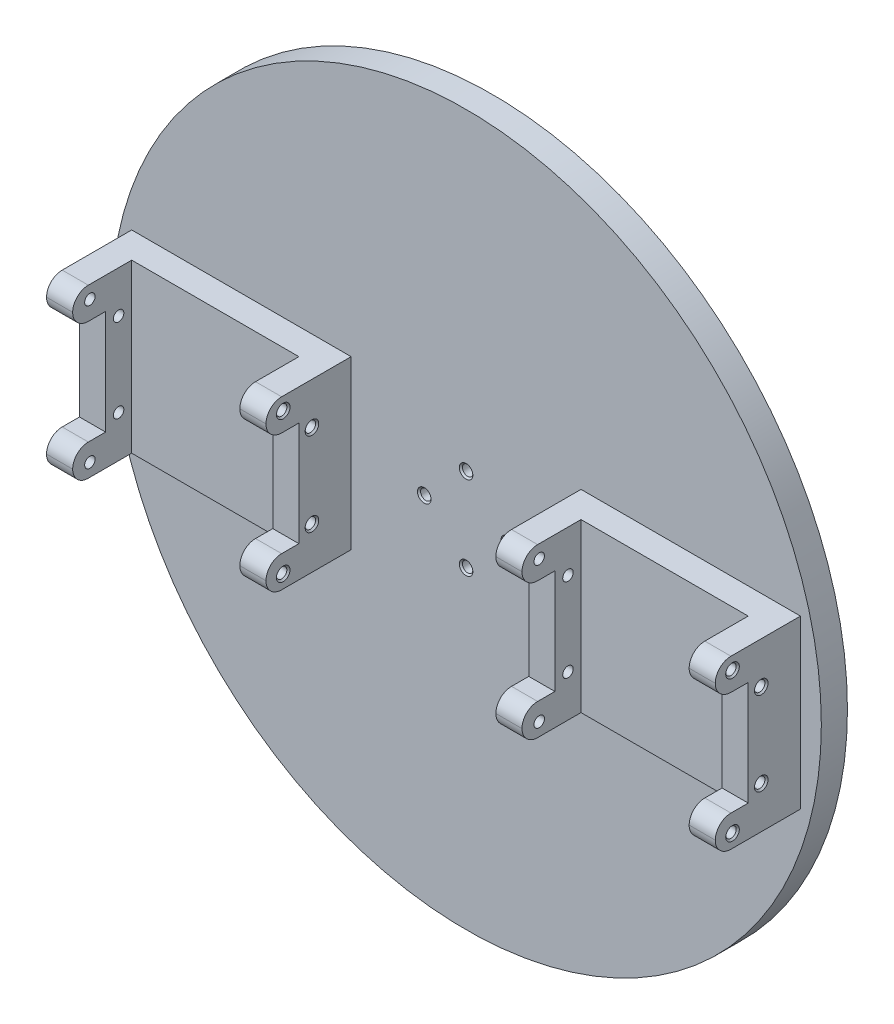
from build123d import *

# Parameters (mm, degrees)
IZIM1_R                                        = 68
Y_KSEKLIK_EKSTR_ZYON1_DEPTH                    = 5
IZIM2_W                                        = 42
IZIM2_H                                        = 32
Y_KSEKLIK_EKSTR_ZYON2_DEPTH                    = 16.3
IZIM3_W                                        = 32
IZIM3_H                                        = 32
KES_EKSTR_ZYON1_DEPTH                          = 11.3
M2_D_Z_BA_L_MAKINE_VIDAS_IN_HAV_A2_D           = 2
M2_D_Z_BA_L_MAKINE_VIDAS_IN_HAV_A2_CSINK_D     = 2.6
M2_D_Z_BA_L_MAKINE_VIDAS_IN_HAV_A2_CSINK_ANGLE = 90
IZIM9_W                                        = 6.3
IZIM9_H                                        = 20
KES_EKSTR_ZYON2_DEPTH                          = 151.005633228
RADYUS1_R                                      = 3
M2_D_Z_BA_L_MAKINE_VIDAS_IN_HAV_A3_D           = 2
M2_D_Z_BA_L_MAKINE_VIDAS_IN_HAV_A3_DEPTH       = 5
M2_D_Z_BA_L_MAKINE_VIDAS_IN_HAV_A3_CSINK_D     = 2.6
M2_D_Z_BA_L_MAKINE_VIDAS_IN_HAV_A3_CSINK_ANGLE = 90
AYNALAMA2_COPY_1_D                             = 2
AYNALAMA2_COPY_1_DEPTH                         = 5
AYNALAMA2_COPY_1_CSINK_D                       = 2.6
AYNALAMA2_COPY_1_CSINK_ANGLE                   = 90


with BuildPart() as part:
    # Çizim1 → Yükseklik-Ekstrüzyon1 (new body)
    with BuildSketch(Plane.XY):
        Circle(IZIM1_R)
    extrude(amount=Y_KSEKLIK_EKSTR_ZYON1_DEPTH)

    # Çizim2 → Yükseklik-Ekstrüzyon2 (add)
    with BuildSketch(Plane.XY.offset(5)):
        with Locations((-43, 0)):
            Rectangle(IZIM2_W, IZIM2_H)
        with Locations((43, 0)):
            Rectangle(IZIM2_W, IZIM2_H)
    extrude(amount=Y_KSEKLIK_EKSTR_ZYON2_DEPTH)

    # Çizim3 → Kes-Ekstrüzyon1 (cut)
    with BuildSketch(Plane.XY.offset(21.3)):
        with Locations((-43, 0)):
            Rectangle(IZIM3_W, IZIM3_H)
        with Locations((43, 0)):
            Rectangle(IZIM3_W, IZIM3_H)
    extrude(amount=-KES_EKSTR_ZYON1_DEPTH, mode=Mode.SUBTRACT)

    # M2 Düz Başlı Makine Vidası İçin Havşa2 (through all)
    with Locations(Plane(origin=(0, 8, 5), x_dir=(1, 0, 0), z_dir=(0, 0, 1))):
        with Locations((0, 0), (8, -8), (0, -16), (-8, -8)):
            CounterSinkHole(M2_D_Z_BA_L_MAKINE_VIDAS_IN_HAV_A2_D / 2, M2_D_Z_BA_L_MAKINE_VIDAS_IN_HAV_A2_CSINK_D / 2, counter_sink_angle=M2_D_Z_BA_L_MAKINE_VIDAS_IN_HAV_A2_CSINK_ANGLE)

    # Çizim9 → Kes-Ekstrüzyon2 (cut, through all)
    with BuildSketch(Plane(origin=(64, 0, 0), x_dir=(0, 0, -1), z_dir=(1, 0, 0))):
        with Locations((-18.15, 0)):
            Rectangle(IZIM9_W, IZIM9_H)
    extrude(amount=-KES_EKSTR_ZYON2_DEPTH, mode=Mode.SUBTRACT)

    # Radyus1
    radyus1_edges = [part.edges().sort_by_distance(p)[0] for p in [
        (-61.5, 10, 21.3),
        (-61.5, 16, 21.3),
        (61.5, -16, 21.3),
        (61.5, -10, 21.3),
        (24.5, -16, 21.3),
        (24.5, -10, 21.3),
        (61.5, 10, 21.3),
        (24.5, 10, 21.3),
        (24.5, 16, 21.3),
        (61.5, 16, 21.3),
        (-24.5, 10, 21.3),
        (-24.5, 16, 21.3),
        (-24.5, -16, 21.3),
        (-24.5, -10, 21.3),
        (-61.5, -16, 21.3),
        (-61.5, -10, 21.3),
    ]]
    fillet(radyus1_edges, radius=RADYUS1_R - 0.0001)  # a hair under: the kernel refuses the full size

    # M2 Düz Başlı Makine Vidası İçin Havşa3
    with Locations(Plane(origin=(64, 13.5, 18), x_dir=(0, 1, 0), z_dir=(1, 0, 0))):
        with Locations((0, 0), (-5.5, -5.5), (-21.5, -5.5), (-27, 0)):
            m2_d_z_ba_l_makine_vidas_in_hav_a3 = CounterSinkHole(M2_D_Z_BA_L_MAKINE_VIDAS_IN_HAV_A3_D / 2, M2_D_Z_BA_L_MAKINE_VIDAS_IN_HAV_A3_CSINK_D / 2, depth=M2_D_Z_BA_L_MAKINE_VIDAS_IN_HAV_A3_DEPTH, counter_sink_angle=M2_D_Z_BA_L_MAKINE_VIDAS_IN_HAV_A3_CSINK_ANGLE)

    # Aynalama1: M2 Düz Başlı Makine Vidası İçin Havşa3 across plane
    add(m2_d_z_ba_l_makine_vidas_in_hav_a3.mirror(Plane(origin=(43, 0, 0), x_dir=(0, 0, 1), z_dir=(1, 0, 0))), mode=Mode.SUBTRACT)

    # Aynalama2: M2 Düz Başlı Makine Vidası İçin Havşa3 across plane
    add(m2_d_z_ba_l_makine_vidas_in_hav_a3.mirror(Plane(origin=(0, 0, 0), x_dir=(0, 0, 1), z_dir=(1, 0, 0))), mode=Mode.SUBTRACT)

    # Aynalama2 copy 1
    with Locations(Plane(origin=(-22, 13.5, 18), x_dir=(0, 1, 0), z_dir=(1, 0, 0))):
        with Locations((0, 0), (-5.5, -5.5), (-21.5, -5.5), (-27, 0)):
            CounterSinkHole(AYNALAMA2_COPY_1_D / 2, AYNALAMA2_COPY_1_CSINK_D / 2, depth=AYNALAMA2_COPY_1_DEPTH, counter_sink_angle=AYNALAMA2_COPY_1_CSINK_ANGLE)


solid = part.part
